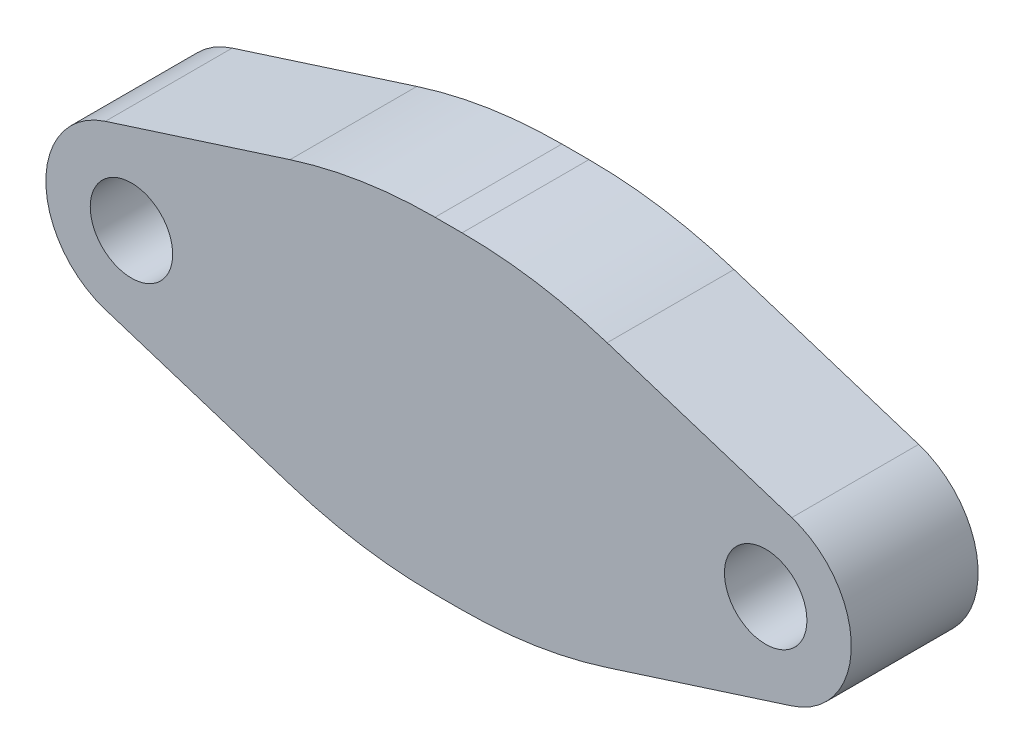
from build123d import *

# Parameters (mm, degrees)
SKETCH1_R           = 1.3
BOSS_EXTRUDE1_DEPTH = 4
SKETCH2_R           = 4.330127019
BOSS_EXTRUDE2_DEPTH = 1.2


with BuildPart() as part:
    # Sketch1 → Boss-Extrude1 (new body)
    with BuildSketch(Plane.XY):
        with BuildLine():
            Line((10.823243212, 2.571433572), (5, 4.435742065))
            ThreePointArc((5, 4.435742065), (2.74093184, 4.97035983), (0.426426599, 5.15))
            Line((0.426426599, 5.15), (-0.426426599, 5.15))
            ThreePointArc((-0.426426599, 5.15), (-2.74093184, 4.97035983), (-5, 4.435742065))
            Line((-5, 4.435742065), (-10.823243212, 2.571433572))
            ThreePointArc((-10.823243212, 2.571433572), (-12.7, 0), (-10.823243212, -2.571433572))
            Line((-10.823243212, -2.571433572), (-5, -4.435742065))
            ThreePointArc((-5, -4.435742065), (-2.74093184, -4.97035983), (-0.426426599, -5.15))
            Line((-0.426426599, -5.15), (0.426426599, -5.15))
            ThreePointArc((0.426426599, -5.15), (2.74093184, -4.97035983), (5, -4.435742065))
            Line((5, -4.435742065), (10.823243212, -2.571433572))
            ThreePointArc((10.823243212, -2.571433572), (12.7, 0), (10.823243212, 2.571433572))
        make_face()
        with Locations((10, 0)):
            Circle(SKETCH1_R, mode=Mode.SUBTRACT)
        with Locations((-10, 0)):
            Circle(SKETCH1_R, mode=Mode.SUBTRACT)
        Polygon((2.165063509, 3.75), (-2.165063509, 3.75), (-4.330127019, 0), (-2.165063509, -3.75), (2.165063509, -3.75), (4.330127019, 0), align=None, mode=Mode.SUBTRACT)
    extrude(amount=BOSS_EXTRUDE1_DEPTH)

    # Sketch2 → Boss-Extrude2 (add)
    with BuildSketch(Plane.XY.offset(4)):
        Circle(SKETCH2_R)
    extrude(amount=-BOSS_EXTRUDE2_DEPTH)


solid = part.part
